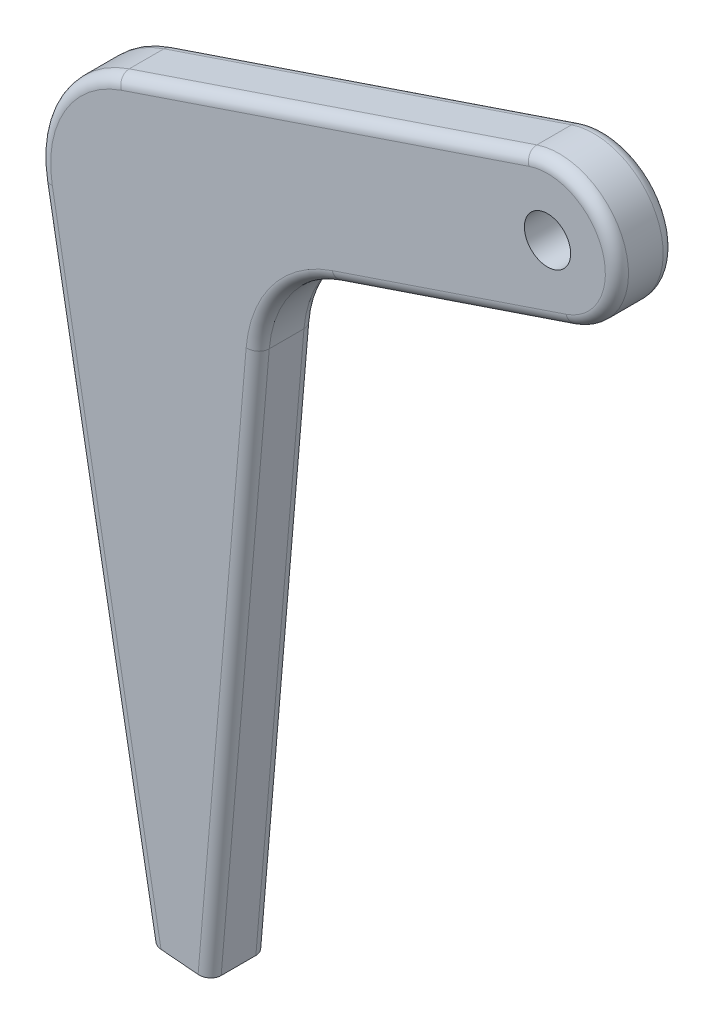
from build123d import *

# Parameters (mm, degrees)
SKETCH1_R           = 2
BOSS_EXTRUDE1_DEPTH = 2.5
FILLET1_R           = 1


with BuildPart() as part:
    # Sketch1 → Boss-Extrude1 (new, symmetric)
    with BuildSketch(Plane.XY):
        with BuildLine():
            Line((-8.07667743, -55.683381942), (-28.300726773, -62.527435526))
            ThreePointArc((-28.300726773, -62.527435526), (-32.967187399, -65.832758653), (-35.059424641, -71.154746916))
            Line((-35.059424641, -71.154746916), (-39.215218896, -120.160323437))
            Line((-39.215218896, -120.160323437), (-44.446651532, -119.716684994))
            Line((-44.446651532, -119.716684994), (-53.801536863, -67.477396645))
            ThreePointArc((-53.801536863, -67.477396645), (-52.567729124, -60.627943396), (-47.163662103, -56.242358944))
            Line((-47.163662103, -56.242358944), (-11.92332257, -44.316618058))
            ThreePointArc((-11.92332257, -44.316618058), (-4.316618058, -48.07667743), (-8.07667743, -55.683381942))
        make_face()
        with Locations((-10, -50)):
            Circle(SKETCH1_R, mode=Mode.SUBTRACT)
    extrude(amount=BOSS_EXTRUDE1_DEPTH, both=True)

    # Fillet1
    fillet1_edges = [part.edges().sort_by_distance(p)[0] for p in [
        (-37.137321769, -95.657535177, -2.5),
        (-32.967187399, -65.832758653, -2.5),
        (-49.124094197, -93.59704082, -2.5),
        (-52.567729124, -60.627943396, -2.5),
        (-29.543492336, -50.279488501, -2.5),
        (-4.316618058, -48.07667743, -2.5),
        (-37.137321769, -95.657535177, 2.5),
        (-32.967187399, -65.832758653, 2.5),
        (-49.124094197, -93.59704082, 2.5),
        (-52.567729124, -60.627943396, 2.5),
        (-29.543492336, -50.279488501, 2.5),
        (-4.316618058, -48.07667743, 2.5),
        (-18.188702102, -59.105408734, -2.5),
        (-18.188702102, -59.105408734, 2.5),
    ]]
    fillet(fillet1_edges, radius=FILLET1_R)


solid = part.part
